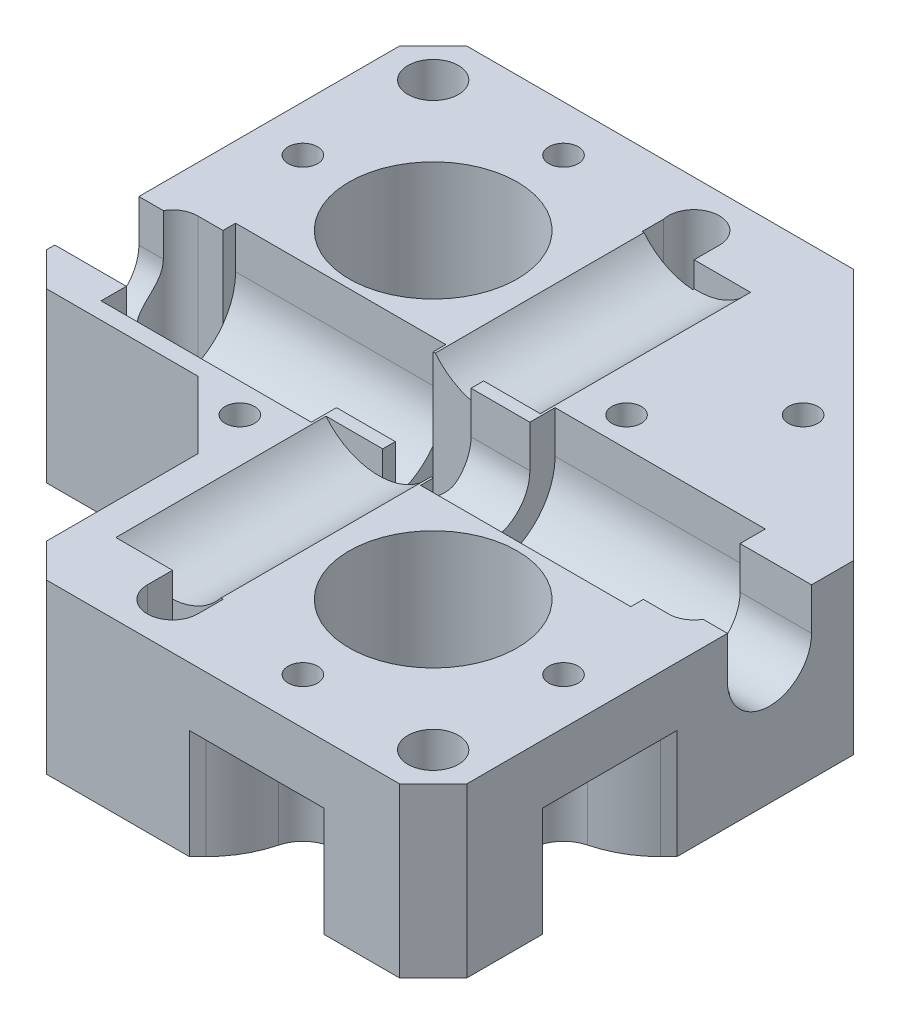
from build123d import *

# Parameters (mm, degrees)
SKETCH1_W               = 80
SKETCH1_H               = 80
BOSS_EXTRUDE1_DEPTH     = 20
CUT_EXTRUDE1_DEPTH      = 61
CUT_EXTRUDE1_DEPTH_BACK = 61
SKETCH2_R               = 1.75
SKETCH3_W               = 25
SKETCH3_H               = 16
CUT_EXTRUDE2_DEPTH      = 13
FILLET1_R               = 8
SKETCH4_W               = 16
SKETCH4_H               = 25
CUT_EXTRUDE3_DEPTH      = 3
BOSS_EXTRUDE2_DEPTH     = 23.5
CUT_EXTRUDE4_DEPTH      = 61
CUT_EXTRUDE4_DEPTH_BACK = 61
CUT_EXTRUDE5_DEPTH      = 61
CUT_EXTRUDE5_DEPTH_BACK = 61
SKETCH7_R               = 10
BOSS_EXTRUDE3_DEPTH     = 1.5
CUT_EXTRUDE6_DEPTH      = 61
CUT_EXTRUDE6_DEPTH_BACK = 61
CHAMFER1_SIZE           = 4
CHAMFER2_SIZE           = 30
CUT_EXTRUDE7_DEPTH      = 61
CUT_EXTRUDE7_DEPTH_BACK = 61
SKETCH10_R              = 1.75
CUT_EXTRUDE11_DEPTH     = 17
SKETCH12_R              = 3
SKETCH12_R_2            = 1.75
CUT_EXTRUDE12_DEPTH     = 8
CUT_EXTRUDE13_START     = -3
SKETCH13_R              = 11
SKETCH13_R_2            = 10
CUT_EXTRUDE13_DEPTH     = 3
CUT_EXTRUDE14_START     = -16
SKETCH14_R              = 1.75
CUT_EXTRUDE14_DEPTH     = 16
CUT_EXTRUDE15_START     = -13
SKETCH15_R              = 1.75
SKETCH15_W              = 8
SKETCH15_H              = 5.5
SKETCH15_R_2            = 4
SKETCH15_W_2            = 5.5
SKETCH15_H_2            = 8
CUT_EXTRUDE15_DEPTH     = 13
CHAMFER3_SIZE           = 4
FILLET2_R               = 12


# Some blends are built 0.0001 mm under size
with BuildPart() as part:
    # Sketch1 → Boss-Extrude1 (new body)
    with BuildSketch(Plane(origin=(0, 0, 0), x_dir=(1, 0, 0), z_dir=(0, 1, 0))):
        Rectangle(SKETCH1_W, SKETCH1_H)
    extrude(amount=-BOSS_EXTRUDE1_DEPTH)

    # Sketch2 → Cut-Extrude1 (cut, two sides: drawn at the far end of the back side and taken through both)
    with BuildSketch(Plane(origin=(0, 0, 0), x_dir=(1, 0, 0), z_dir=(0, 1, 0)).offset(-CUT_EXTRUDE1_DEPTH_BACK)):
        with Locations(Location((-11.5, -11.5, 0), (0, 0, 270))):
            Circle(SKETCH2_R)
        with Locations(Location((11.5, 11.5, 0), (0, 0, 270))):
            Circle(SKETCH2_R)
        with Locations(Location((22, 22, 0), (0, 0, 270))):
            Circle(SKETCH2_R)
        with Locations(Location((19, -34.5, 0), (0, 0, 270))):
            Circle(SKETCH2_R)
        with Locations(Location((34.5, -19, 0), (0, 0, 270))):
            Circle(SKETCH2_R)
        with Locations(Location((-34.5, 19, 0), (0, 0, 270))):
            Circle(SKETCH2_R)
        with Locations(Location((-19, 34.5, 0), (0, 0, 270))):
            Circle(SKETCH2_R)
    extrude(amount=CUT_EXTRUDE1_DEPTH + CUT_EXTRUDE1_DEPTH_BACK, mode=Mode.SUBTRACT)

    # Sketch3 → Cut-Extrude2 (cut)
    with BuildSketch(Plane(origin=(0, 0, 0), x_dir=(1, 0, 0), z_dir=(0, 1, 0))):
        with Locations((19, 0)):
            Rectangle(SKETCH3_W, SKETCH3_H)
        with Locations((-19, 0)):
            Rectangle(SKETCH3_W, SKETCH3_H)
    extrude(amount=-CUT_EXTRUDE2_DEPTH, mode=Mode.SUBTRACT)

    # Fillet1
    fillet1_edges = [part.edges().sort_by_distance(p)[0] for p in [
        (19, -13, 8),
        (19, -13, -8),
        (-19, -13, 8),
        (-19, -13, -8),
    ]]
    fillet(fillet1_edges, radius=FILLET1_R - 0.0001)  # a hair under: the kernel refuses the full size

    # Sketch4 → Cut-Extrude3 (cut)
    with BuildSketch(Plane(origin=(0, 0, 0), x_dir=(1, 0, 0), z_dir=(0, 1, 0))):
        with Locations((0, -19)):
            Rectangle(SKETCH4_W, SKETCH4_H)
        with Locations((0, 19)):
            Rectangle(SKETCH4_W, SKETCH4_H)
    extrude(amount=-CUT_EXTRUDE3_DEPTH, mode=Mode.SUBTRACT)

    # Sketch5 → Boss-Extrude2 (add)
    with BuildSketch(Plane(origin=(0, 0, 31.5), x_dir=(-1, 0, 0), z_dir=(0, 0, -1))):
        with BuildLine():
            ThreePointArc((1.5e-08, -3), (-3.464101608, -2.211102554), (-6.244997998, 0))
            Line((-6.244997998, 0), (-8, 0))
            Line((-8, 0), (-8, -3))
            Line((-8, -3), (1.5e-08, -3))
        make_face()
        with BuildLine():
            Line((8, -3), (8, 0))
            Line((8, 0), (6.244997998, 0))
            ThreePointArc((6.244997998, 0), (3.464101622, -2.211102548), (1.5e-08, -3))
            Line((1.5e-08, -3), (8, -3))
        make_face()
    boss_extrude2 = extrude(amount=BOSS_EXTRUDE2_DEPTH)

    # Mirror1: Boss-Extrude2 across plane
    add(boss_extrude2.mirror(Plane.XY))

    # Sketch6 → Cut-Extrude4 (cut, two sides: drawn at the far end of the back side and taken through both)
    with BuildSketch(Plane(origin=(0, 0, 0), x_dir=(0, 0, -1), z_dir=(1, 0, 0)).offset(-CUT_EXTRUDE4_DEPTH_BACK)):
        with BuildLine():
            ThreePointArc((-5, -5), (0, -10), (5, -5))
            Line((5, -5), (-5, -5))
        make_face()
        with BuildLine():
            Line((-5, -5), (5, -5))
            ThreePointArc((5, -5), (3.535533906, -1.464466094), (0, 0))
            ThreePointArc((0, 0), (-3.535533906, -1.464466094), (-5, -5))
        make_face()
        with BuildLine():
            Line((-5, 0), (-5, -5))
            ThreePointArc((-5, -5), (-3.535533906, -1.464466094), (0, 0))
            Line((0, 0), (-5, 0))
        make_face()
        with BuildLine():
            ThreePointArc((0, 0), (3.535533906, -1.464466094), (5, -5))
            Line((5, -5), (5, 0))
            Line((5, 0), (0, 0))
        make_face()
    extrude(amount=CUT_EXTRUDE4_DEPTH + CUT_EXTRUDE4_DEPTH_BACK, mode=Mode.SUBTRACT)

    # Sketch7 → Cut-Extrude5 (cut, two sides: drawn at the far end of the back side and taken through both)
    with BuildSketch(Plane(origin=(0, 0, 0), x_dir=(1, 0, 0), z_dir=(0, 1, 0)).offset(-CUT_EXTRUDE5_DEPTH_BACK)):
        with Locations(Location((19, -19, 0), (0, 0, 270))):
            Circle(SKETCH7_R)
        with Locations(Location((-19, 19, 0), (0, 0, 270))):
            Circle(SKETCH7_R)
    extrude(amount=CUT_EXTRUDE5_DEPTH + CUT_EXTRUDE5_DEPTH_BACK, mode=Mode.SUBTRACT)

    # Sketch8 → Boss-Extrude3 (add)
    with BuildSketch(Plane(origin=(0, 0, -6.5), x_dir=(-1, 0, 0), z_dir=(0, 0, -1))):
        with BuildLine():
            ThreePointArc((0, -3), (-3.464101615, -2.211102551), (-6.244997998, 0))
            Line((-6.244997998, 0), (-6.5, 0))
            Line((-6.5, 0), (-6.5, -3))
            Line((-6.5, -3), (0, -3))
        make_face()
        with BuildLine():
            Line((6.5, -3), (6.5, 0))
            Line((6.5, 0), (6.244997998, 0))
            ThreePointArc((6.244997998, 0), (3.464101615, -2.211102551), (0, -3))
            Line((0, -3), (6.5, -3))
        make_face()
    boss_extrude3 = extrude(amount=BOSS_EXTRUDE3_DEPTH)

    # Mirror2: Boss-Extrude3 across plane
    add(boss_extrude3.mirror(Plane.XY))

    # Sketch9 → Cut-Extrude6 (cut, two sides: drawn at the far end of the back side and taken through both)
    with BuildSketch(Plane(origin=(0, 0, 0), x_dir=(1, 0, 0), z_dir=(0, 1, 0)).offset(-CUT_EXTRUDE6_DEPTH_BACK)):
        Polygon((-10, -18), (-18, -10), (-18, -18), align=None)
        Polygon((-10, -40), (-10, -18), (-18, -18), (-18, -10), (-40, -10), (-40, -40), align=None)
    extrude(amount=CUT_EXTRUDE6_DEPTH + CUT_EXTRUDE6_DEPTH_BACK, mode=Mode.SUBTRACT)

    # Chamfer1
    chamfer1_edges = [part.edges().sort_by_distance(p)[0] for p in [
        (-10, -10, 40),
        (-40, -10, 10),
        (40, -10, 40),
        (-40, -10, -40),
    ]]
    chamfer(chamfer1_edges, length=CHAMFER1_SIZE)

    # Chamfer2
    chamfer2_edges = [part.edges().sort_by_distance(p)[0] for p in [
        (40, -10, -40),
    ]]
    chamfer(chamfer2_edges, length=CHAMFER2_SIZE)

    # Sketch10 → Cut-Extrude7 (cut, two sides: drawn at the far end of the back side and taken through both)
    with BuildSketch(Plane(origin=(0, 0, 0), x_dir=(1, 0, 0), z_dir=(0, 1, 0)).offset(-CUT_EXTRUDE7_DEPTH_BACK)):
        with Locations(Location((3.5, -3.5, 0), (0, 0, 270))):
            Circle(SKETCH10_R)
        with Locations(Location((-3.5, 3.5, 0), (0, 0, 270))):
            Circle(SKETCH10_R)
        with Locations(Location((34.5, -3.5, 0), (0, 0, 270))):
            Circle(SKETCH10_R)
        with Locations(Location((3.5, -34.5, 0), (0, 0, 270))):
            Circle(SKETCH10_R)
        with Locations(Location((34.5, -34.5, 0), (0, 0, 270))):
            Circle(SKETCH10_R)
        with Locations(Location((-3.5, 34.5, 0), (0, 0, 270))):
            Circle(SKETCH10_R)
        with Locations(Location((-34.5, 3.5, 0), (0, 0, 270))):
            Circle(SKETCH10_R)
        with Locations(Location((-34.5, 34.5, 0), (0, 0, 270))):
            Circle(SKETCH10_R)
    extrude(amount=CUT_EXTRUDE7_DEPTH + CUT_EXTRUDE7_DEPTH_BACK, mode=Mode.SUBTRACT)

    # Sketch11 → Cut-Extrude11 (cut)
    with BuildSketch(Plane(origin=(0, 0, 0), x_dir=(1, 0, 0), z_dir=(0, 1, 0))):
        with BuildLine():
            ThreePointArc((-3.5, 0.5), (-1.378679656, 1.378679656), (-0.5, 3.5))
            Line((-0.5, 3.5), (-3.5, 3.5))
            Line((-3.5, 3.5), (-3.5, 0.5))
        make_face()
        with BuildLine():
            ThreePointArc((-3.5, 6.5), (-1.378679656, 5.621320344), (-0.5, 3.5))
            Line((-0.5, 3.5), (-0.5, 6.5))
            Line((-0.5, 6.5), (-3.5, 6.5))
        make_face()
        with BuildLine():
            Line((-3.5, 3.5), (-0.5, 3.5))
            ThreePointArc((-0.5, 3.5), (-1.378679656, 5.621320344), (-3.5, 6.5))
            Line((-3.5, 6.5), (-3.5, 3.5))
        make_face()
        with BuildLine():
            Line((-3.5, 0.5), (-3.5, 3.5))
            Line((-3.5, 3.5), (-6.5, 3.5))
            ThreePointArc((-6.5, 3.5), (-5.621320344, 1.378679656), (-3.5, 0.5))
        make_face()
        with BuildLine():
            Line((-6.5, 3.5), (-3.5, 3.5))
            Line((-3.5, 3.5), (-3.5, 6.5))
            ThreePointArc((-3.5, 6.5), (-5.621320344, 5.621320344), (-6.5, 3.5))
        make_face()
        with BuildLine():
            ThreePointArc((-6.5, 3.5), (-5.621320344, 5.621320344), (-3.5, 6.5))
            Line((-3.5, 6.5), (-6.5, 6.5))
            Line((-6.5, 6.5), (-6.5, 3.5))
        make_face()
        with BuildLine():
            Line((-6.5, 0.5), (-3.5, 0.5))
            ThreePointArc((-3.5, 0.5), (-5.621320344, 1.378679656), (-6.5, 3.5))
            Line((-6.5, 3.5), (-6.5, 0.5))
        make_face()
        with BuildLine():
            ThreePointArc((3.5, -0.5), (1.378679656, -1.378679656), (0.5, -3.5))
            Line((0.5, -3.5), (3.5, -3.5))
            Line((3.5, -3.5), (3.5, -0.5))
        make_face()
        with BuildLine():
            ThreePointArc((3.5, -6.5), (1.378679656, -5.621320344), (0.5, -3.5))
            Line((0.5, -3.5), (0.5, -6.5))
            Line((0.5, -6.5), (3.5, -6.5))
        make_face()
        with BuildLine():
            Line((3.5, -3.5), (0.5, -3.5))
            ThreePointArc((0.5, -3.5), (1.378679656, -5.621320344), (3.5, -6.5))
            Line((3.5, -6.5), (3.5, -3.5))
        make_face()
        with BuildLine():
            Line((3.5, -0.5), (3.5, -3.5))
            Line((3.5, -3.5), (6.5, -3.5))
            ThreePointArc((6.5, -3.5), (5.621320344, -1.378679656), (3.5, -0.5))
        make_face()
        with BuildLine():
            Line((6.5, -3.5), (3.5, -3.5))
            Line((3.5, -3.5), (3.5, -6.5))
            ThreePointArc((3.5, -6.5), (5.621320344, -5.621320344), (6.5, -3.5))
        make_face()
        with BuildLine():
            Line((6.5, -0.5), (3.5, -0.5))
            ThreePointArc((3.5, -0.5), (5.621320344, -1.378679656), (6.5, -3.5))
            Line((6.5, -3.5), (6.5, -0.5))
        make_face()
        with BuildLine():
            ThreePointArc((6.5, -3.5), (5.621320344, -5.621320344), (3.5, -6.5))
            Line((3.5, -6.5), (6.5, -6.5))
            Line((6.5, -6.5), (6.5, -3.5))
        make_face()
        with BuildLine():
            ThreePointArc((31.5, -3.5), (32.378679656, -1.378679656), (34.5, -0.5))
            Line((34.5, -0.5), (31.5, -0.5))
            Line((31.5, -0.5), (31.5, -3.5))
        make_face()
        with BuildLine():
            ThreePointArc((37.5, -3.5), (36.621320344, -1.378679656), (34.5, -0.5))
            Line((34.5, -0.5), (34.5, -6.5))
            ThreePointArc((34.5, -6.5), (36.621320344, -5.621320344), (37.5, -3.5))
        make_face()
        with BuildLine():
            Line((34.5, -6.5), (34.5, -0.5))
            ThreePointArc((34.5, -0.5), (32.378679656, -1.378679656), (31.5, -3.5))
            ThreePointArc((31.5, -3.5), (32.378679656, -5.621320344), (34.5, -6.5))
        make_face()
        with BuildLine():
            Line((31.5, -6.5), (34.5, -6.5))
            ThreePointArc((34.5, -6.5), (32.378679656, -5.621320344), (31.5, -3.5))
            Line((31.5, -3.5), (31.5, -6.5))
        make_face()
        with BuildLine():
            ThreePointArc((-31.5, 3.5), (-32.378679656, 5.621320344), (-34.5, 6.5))
            Line((-34.5, 6.5), (-34.5, 0.5))
            ThreePointArc((-34.5, 0.5), (-32.378679656, 1.378679656), (-31.5, 3.5))
        make_face()
        with BuildLine():
            Line((-31.5, 6.5), (-34.5, 6.5))
            ThreePointArc((-34.5, 6.5), (-32.378679656, 5.621320344), (-31.5, 3.5))
            Line((-31.5, 3.5), (-31.5, 6.5))
        make_face()
        with BuildLine():
            Line((-34.5, 0.5), (-34.5, 6.5))
            ThreePointArc((-34.5, 6.5), (-37.5, 3.5), (-34.5, 0.5))
        make_face()
        with BuildLine():
            ThreePointArc((-31.5, 3.5), (-32.378679656, 1.378679656), (-34.5, 0.5))
            Line((-34.5, 0.5), (-31.5, 0.5))
            Line((-31.5, 0.5), (-31.5, 3.5))
        make_face()
        with BuildLine():
            Line((3.5, -31.5), (0.5, -31.5))
            Line((0.5, -31.5), (0.5, -34.5))
            ThreePointArc((0.5, -34.5), (1.378679656, -32.378679656), (3.5, -31.5))
        make_face()
        with BuildLine():
            Line((6.5, -31.5), (3.5, -31.5))
            ThreePointArc((3.5, -31.5), (5.621320344, -32.378679656), (6.5, -34.5))
            Line((6.5, -34.5), (6.5, -31.5))
        make_face()
        with BuildLine():
            ThreePointArc((6.5, -34.5), (5.621320344, -32.378679656), (3.5, -31.5))
            ThreePointArc((3.5, -31.5), (1.378679656, -32.378679656), (0.5, -34.5))
            Line((0.5, -34.5), (6.5, -34.5))
        make_face()
        with BuildLine():
            Line((6.5, -34.5), (0.5, -34.5))
            ThreePointArc((0.5, -34.5), (3.5, -37.5), (6.5, -34.5))
        make_face()
        with BuildLine():
            ThreePointArc((-6.463181152, 33.835299939), (-3.165616731, 31.481646717), (-0.463181152, 34.5))
            Line((-0.463181152, 34.5), (-6.463181152, 34.5))
            Line((-6.463181152, 34.5), (-6.463181152, 33.835299939))
        make_face()
        with BuildLine():
            Line((-6.463181152, 34.5), (-0.463181152, 34.5))
            ThreePointArc((-0.463181152, 34.5), (-3.834383269, 37.518353283), (-6.463181152, 33.835299939))
            Line((-6.463181152, 33.835299939), (-6.463181152, 34.5))
        make_face()
        with BuildLine():
            Line((-0.463181152, 31.328359138), (-0.463181152, 34.5))
            ThreePointArc((-0.463181152, 34.5), (-3.165616731, 31.481646717), (-6.463181152, 33.835299939))
            Line((-6.463181152, 33.835299939), (-6.463181152, 31.328359138))
            Line((-6.463181152, 31.328359138), (-0.463181152, 31.328359138))
        make_face()
    extrude(amount=-CUT_EXTRUDE11_DEPTH, mode=Mode.SUBTRACT)

    # Sketch12 → Cut-Extrude12 (cut)
    # profile 1 of 2: a face of its own
    with BuildSketch(Plane(origin=(0, 0, 0), x_dir=(1, 0, 0), z_dir=(0, 1, 0))):
        with Locations(Location((34.5, -34.5, 0), (0, 0, 270))):
            Circle(SKETCH12_R)
        with Locations(Location((34.5, -34.5, 0), (0, 0, 270))):
            Circle(SKETCH12_R_2, mode=Mode.SUBTRACT)
    # profile 2 of 2: a face of its own
    with BuildSketch(Plane(origin=(0, 0, 0), x_dir=(1, 0, 0), z_dir=(0, 1, 0))):
        with Locations(Location((-34.5, 34.5, 0), (0, 0, 270))):
            Circle(SKETCH12_R)
        with Locations(Location((-34.5, 34.5, 0), (0, 0, 270))):
            Circle(SKETCH12_R_2, mode=Mode.SUBTRACT)
    extrude(amount=-CUT_EXTRUDE12_DEPTH, mode=Mode.SUBTRACT)

    # Sketch13 → Cut-Extrude13 (cut)
    # profile 1 of 2: a face of its own
    with BuildSketch(Plane.XZ.offset(20).offset(CUT_EXTRUDE13_START)):
        with Locations(Location((19, 19, 0), (0, 0, 270))):
            Circle(SKETCH13_R)
        with Locations(Location((19, 19, 0), (0, 0, 270))):
            Circle(SKETCH13_R_2, mode=Mode.SUBTRACT)
    # profile 2 of 2: a face of its own
    with BuildSketch(Plane.XZ.offset(20).offset(CUT_EXTRUDE13_START)):
        with Locations(Location((-19, -19, 0), (0, 0, 270))):
            Circle(SKETCH13_R)
        with Locations(Location((-19, -19, 0), (0, 0, 270))):
            Circle(SKETCH13_R_2, mode=Mode.SUBTRACT)
    extrude(amount=CUT_EXTRUDE13_DEPTH, mode=Mode.SUBTRACT)

    # Sketch14 → Cut-Extrude14 (cut)
    # profile 1 of 7: a face of its own
    with BuildSketch(Plane.XZ.offset(20).offset(CUT_EXTRUDE14_START)):
        Polygon((-34.5, -15.824573519), (-37.25, -17.41228676), (-37.25, -20.58771324), (-34.5, -22.175426481), (-31.75, -20.58771324), (-31.75, -17.41228676), align=None)
        with Locations(Location((-34.5, -19, 0), (0, 0, 270))):
            Circle(SKETCH14_R, mode=Mode.SUBTRACT)
    # profile 2 of 7: a face of its own
    with BuildSketch(Plane.XZ.offset(20).offset(CUT_EXTRUDE14_START)):
        Polygon((-15.824573519, -34.5), (-17.41228676, -31.75), (-20.58771324, -31.75), (-22.175426481, -34.5), (-20.58771324, -37.25), (-17.41228676, -37.25), align=None)
        with Locations(Location((-19, -34.5, 0), (0, 0, 270))):
            Circle(SKETCH14_R, mode=Mode.SUBTRACT)
    # profile 3 of 7: a face of its own
    with BuildSketch(Plane.XZ.offset(20).offset(CUT_EXTRUDE14_START)):
        Polygon((34.5, 22.175426481), (31.75, 20.58771324), (31.75, 17.41228676), (34.5, 15.824573519), (37.25, 17.41228676), (37.25, 20.58771324), align=None)
        with Locations(Location((34.5, 19, 0), (0, 0, 270))):
            Circle(SKETCH14_R, mode=Mode.SUBTRACT)
    # profile 4 of 7: a face of its own
    with BuildSketch(Plane.XZ.offset(20).offset(CUT_EXTRUDE14_START)):
        Polygon((22.175426481, 34.5), (20.58771324, 37.25), (17.41228676, 37.25), (15.824573519, 34.5), (17.41228676, 31.75), (20.58771324, 31.75), align=None)
        with Locations(Location((19, 34.5, 0), (0, 0, 270))):
            Circle(SKETCH14_R, mode=Mode.SUBTRACT)
    # profile 5 of 7: a face of its own
    with BuildSketch(Plane.XZ.offset(20).offset(CUT_EXTRUDE14_START)):
        Polygon((-8.324573519, 11.5), (-9.91228676, 14.25), (-13.08771324, 14.25), (-14.675426481, 11.5), (-13.08771324, 8.75), (-9.91228676, 8.75), align=None)
        with Locations(Location((-11.5, 11.5, 0), (0, 0, 270))):
            Circle(SKETCH14_R, mode=Mode.SUBTRACT)
    # profile 6 of 7: a face of its own
    with BuildSketch(Plane.XZ.offset(20).offset(CUT_EXTRUDE14_START)):
        Polygon((8.324573519, -11.5), (9.91228676, -14.25), (13.08771324, -14.25), (14.675426481, -11.5), (13.08771324, -8.75), (9.91228676, -8.75), align=None)
        with Locations(Location((11.5, -11.5, 0), (0, 0, 270))):
            Circle(SKETCH14_R, mode=Mode.SUBTRACT)
    # profile 7 of 7: a face of its own
    with BuildSketch(Plane.XZ.offset(20).offset(CUT_EXTRUDE14_START)):
        Polygon((22, -18.824573519), (19.25, -20.41228676), (19.25, -23.58771324), (22, -25.175426481), (24.75, -23.58771324), (24.75, -20.41228676), align=None)
        with Locations(Location((22, -22, 0), (0, 0, 270))):
            Circle(SKETCH14_R, mode=Mode.SUBTRACT)
    extrude(amount=CUT_EXTRUDE14_DEPTH, mode=Mode.SUBTRACT)

    # Sketch15 → Cut-Extrude15 (cut)
    # profile 1 of 11: a face of its own
    with BuildSketch(Plane.XZ.offset(20).offset(CUT_EXTRUDE15_START)):
        with Locations(Location((11.5, -11.5, 0), (0, 0, 270))):
            Circle(SKETCH15_R)
    # profile 2 of 11: a face of its own
    with BuildSketch(Plane.XZ.offset(20).offset(CUT_EXTRUDE15_START)):
        Polygon((9.91228676, -14.25), (13.08771324, -8.75), (40, -10), (10, -40), align=None)
        with Locations(Location((22, -22, 0), (0, 0, 270))):
            Circle(SKETCH15_R, mode=Mode.SUBTRACT)
    # profile 3 of 11: a face of its own
    with BuildSketch(Plane.XZ.offset(20).offset(CUT_EXTRUDE15_START)):
        with Locations((-19, -37.25)):
            Rectangle(SKETCH15_W, SKETCH15_H)
    # profile 4 of 11: a face of its own
    with BuildSketch(Plane.XZ.offset(20).offset(CUT_EXTRUDE15_START)):
        with Locations((-19, -34.5)):
            Circle(SKETCH15_R_2)
    # profile 5 of 11: a face of its own
    with BuildSketch(Plane.XZ.offset(20).offset(CUT_EXTRUDE15_START)):
        with Locations((-34.5, -19)):
            Circle(SKETCH15_R_2)
    # profile 6 of 11: a face of its own
    with BuildSketch(Plane.XZ.offset(20).offset(CUT_EXTRUDE15_START)):
        with Locations((-37.25, -19)):
            Rectangle(SKETCH15_W_2, SKETCH15_H_2)
    # profile 7 of 11: a face of its own
    with BuildSketch(Plane.XZ.offset(20).offset(CUT_EXTRUDE15_START)):
        Polygon((-18, 10), (-10, 18), (-8.324573519, 11.5), (-13.08771324, 8.75), align=None)
    # profile 8 of 11: a face of its own
    with BuildSketch(Plane.XZ.offset(20).offset(CUT_EXTRUDE15_START)):
        with Locations((34.5, 19)):
            Circle(SKETCH15_R_2)
    # profile 9 of 11: a face of its own
    with BuildSketch(Plane.XZ.offset(20).offset(CUT_EXTRUDE15_START)):
        with Locations((37.25, 19)):
            Rectangle(SKETCH15_W_2, SKETCH15_H_2)
    # profile 10 of 11: a face of its own
    with BuildSketch(Plane.XZ.offset(20).offset(CUT_EXTRUDE15_START)):
        with Locations((19, 34.5)):
            Circle(SKETCH15_R_2)
    # profile 11 of 11: a face of its own
    with BuildSketch(Plane.XZ.offset(20).offset(CUT_EXTRUDE15_START)):
        with Locations((19, 37.25)):
            Rectangle(SKETCH15_W, SKETCH15_H)
    extrude(amount=CUT_EXTRUDE15_DEPTH, mode=Mode.SUBTRACT)

    # Chamfer3
    chamfer3_edges = [part.edges().sort_by_distance(p)[0] for p in [
        (-40, -13.5, -23),
        (-40, -13.5, -15),
        (-15, -13.5, -40),
        (-23, -13.5, -40),
        (40, -13.5, 23),
        (40, -13.5, 15),
        (15, -13.5, 40),
        (23, -13.5, 40),
    ]]
    chamfer(chamfer3_edges, length=CHAMFER3_SIZE)

    # Fillet2
    # the kernel refuses this fillet: 12 mm, written as the material it takes off along each edge
    with BuildSketch(Plane(origin=(15, -7, 36), x_dir=(0.05014793839009291, 0, -0.9987418006047526), z_dir=(0, -1, 0)), Plane(origin=(36, -7, 23), x_dir=(-0.9987418006047525, 0, -0.0501479383900949), z_dir=(0, -1, 0)), Plane(origin=(-15, -7, -36), x_dir=(-0.05014793839009234, 0, 0.9987418006047526), z_dir=(0, -1, 0)), Plane(origin=(-36, -7, -23), x_dir=(0.9987418006047526, 0, 0.050147938390093766), z_dir=(0, -1, 0))) as fillet2_piece_1:
        with BuildLine():
            CenterArc((4.887677515, -11.759235885), FILLET2_R, 101.496660345, 30.62886878)
            Line((-3.161408316, -2.859111319), (-3.966316899, -1.969098862))
            Line((-3.966316899, -1.969098862), (-0.804908583, 0.890012457))
            Line((-0.804908583, 0.890012457), (0.060177526, 1.198490161))
            ThreePointArc((0.060177526, 1.198490161), (1.558290227, 1.123268253), (2.25677474, 1.175923588))
            Line((2.25677474, 1.175923588), (2.495947719, 0))
        make_face()
    extrude(amount=23.656283379, mode=Mode.SUBTRACT)
    with BuildSketch(Plane(origin=(23, -7, 36), x_dir=(0.7071067811865476, 0, 0.7071067811865476), z_dir=(0, -1, 0)), Plane(origin=(36, -7, 15), x_dir=(0.707106781186547, 0, -0.7071067811865479), z_dir=(0, -1, 0)), Plane(origin=(-23, -7, -36), x_dir=(-0.7071067811865475, 0, -0.7071067811865475), z_dir=(0, -1, 0)), Plane(origin=(-36, -7, -15), x_dir=(-0.7071067811865476, 0, 0.7071067811865476), z_dir=(0, -1, 0))) as fillet2_piece_2:
        with BuildLine():
            CenterArc((4.262513352, -12), FILLET2_R, 90, 30.62886878)
            Line((-1.851187134, -1.674174785), (-2.462557183, -0.641592264))
            ThreePointArc((-2.462557183, -0.641592264), (-1.909188309, -0.212132034), (-0.848528137, 0.848528137))
            Line((-0.848528137, 0.848528137), (0, 1.2))
            Line((0, 1.2), (4.262513352, 1.2))
            Line((4.262513352, 1.2), (4.262513352, 0))
        make_face()
    extrude(amount=23.656283379, mode=Mode.SUBTRACT)


solid = part.part
